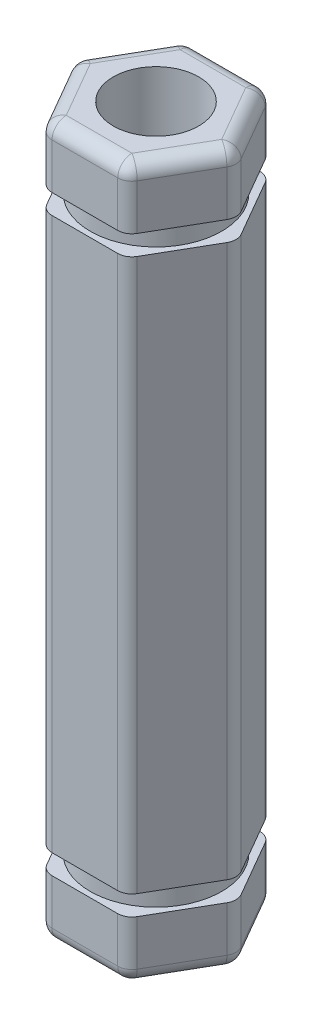
from build123d import *

# Parameters (mm, degrees)
SKETCH1_R           = 1.5
BOSS_EXTRUDE1_DEPTH = 25
FILLET1_R           = 0.5
SKETCH2_W           = 0.5
SKETCH2_H           = 0.7


with BuildPart() as part:
    # Sketch1 → Boss-Extrude1 (new body)
    with BuildSketch(Plane(origin=(0, 0, 0), x_dir=(1, 0, 0), z_dir=(0, 1, 0))):
        Polygon((-1.443375673, 2.5), (-2.886751346, 0), (-1.443375673, -2.5), (1.443375673, -2.5), (2.886751346, 0), (1.443375673, 2.5), align=None)
        Circle(SKETCH1_R, mode=Mode.SUBTRACT)
    extrude(amount=BOSS_EXTRUDE1_DEPTH)

    # Fillet1
    fillet1_edges = [part.edges().sort_by_distance(p)[0] for p in [
        (0, 25, -2.5),
        (0, 0, -2.5),
        (2.165063509, 25, -1.25),
        (1.443375673, 12.5, -2.5),
        (2.165063509, 0, -1.25),
        (2.165063509, 25, 1.25),
        (2.886751346, 12.5, 0),
        (2.165063509, 0, 1.25),
        (-2.165063509, 25, 1.25),
        (-2.165063509, 0, 1.25),
        (-1.443375673, 12.5, -2.5),
        (-2.165063509, 25, -1.25),
        (-2.886751346, 12.5, 0),
        (-2.165063509, 0, -1.25),
        (-1.443375673, 12.5, 2.5),
        (0, 25, 2.5),
        (1.443375673, 12.5, 2.5),
        (0, 0, 2.5),
    ]]
    fillet(fillet1_edges, radius=FILLET1_R)

    # Sketch2 → Cut-Revolve1 (revolve, cut)
    with BuildSketch(Plane.XY):
        with Locations((2.559401077, 22.55)):
            Rectangle(SKETCH2_W, SKETCH2_H)
        with Locations((2.559401077, 2.45)):
            Rectangle(SKETCH2_W, SKETCH2_H)
    revolve(axis=Axis((0, 25, 0), (0, -1, 0)), mode=Mode.SUBTRACT)


solid = part.part
